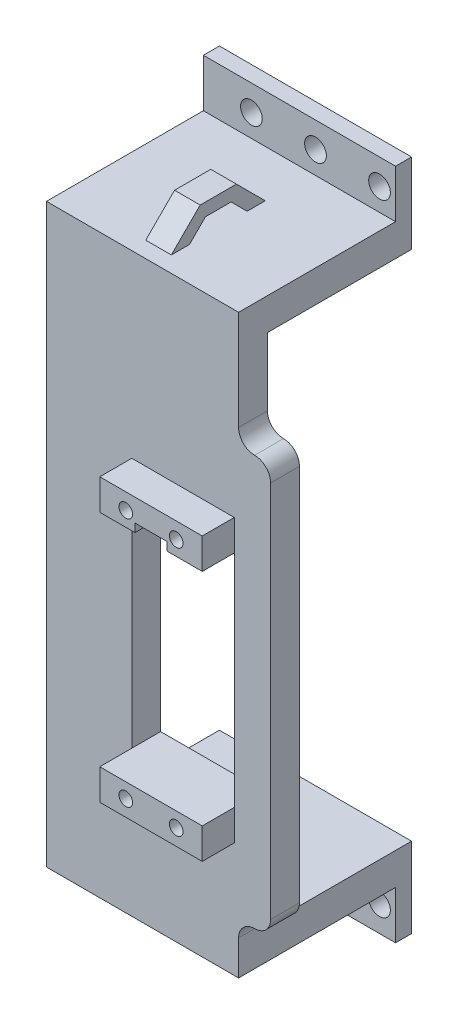
from build123d import *

# Parameters (mm, degrees)
SKETCH1_W             = 76.2
SKETCH1_H             = 114.3
BOSS_EXTRUDE1_DEPTH   = 2.54
SKETCH2_W             = 20.32
SKETCH2_H             = 41.91
CUT_EXTRUDE1_DEPTH    = 138.394983897
SKETCH3_W             = 76.2
SKETCH3_H             = 6.35
BOSS_EXTRUDE2_DEPTH   = 28.575
SKETCH4_W             = 76.2
SKETCH4_H             = 9.525
BOSS_EXTRUDE3_DEPTH   = 3.175
F_6_CLEARANCE_HOLE1_D = 4.3053
SKETCH9_W             = 76.2
SKETCH9_H             = 114.3
SKETCH9_W_2           = 20.32
SKETCH9_H_2           = 41.91
BOSS_EXTRUDE4_DEPTH   = 3.175
SKETCH10_W            = 38.1
SKETCH10_H            = 133.35
CUT_EXTRUDE3_DEPTH    = 150.381641191
SKETCH11_W            = 20.32
SKETCH11_H            = 6.985
BOSS_EXTRUDE5_DEPTH   = 6.35
F_6_32_TAPPED_HOLE1_D = 2.7051
SKETCH15_W            = 6.35
SKETCH15_H            = 2.54
CUT_EXTRUDE4_DEPTH    = 151.965824692
SKETCH16_W            = 20.32
SKETCH16_H            = 43.688
CUT_EXTRUDE5_DEPTH    = 151.965824692
SKETCH17_W            = 6.35
SKETCH17_H            = 81.28
BOSS_EXTRUDE6_DEPTH   = 5.715
FILLET1_START         = -28.575
FILLET1_DEPTH         = 35.575
FILLET1_2_DEPTH       = 5.715
BOSS_EXTRUDE7_START   = -19.05
BOSS_EXTRUDE7_DEPTH   = 2.54


with BuildPart() as part:
    # Sketch1 → Boss-Extrude1 (new body)
    with BuildSketch(Plane.XY):
        with Locations((38.1, 57.15)):
            Rectangle(SKETCH1_W, SKETCH1_H)
    extrude(amount=BOSS_EXTRUDE1_DEPTH)

    # Sketch2 → Cut-Extrude1 (cut, through all)
    with BuildSketch(Plane.XY.offset(2.54)):
        with Locations((65.18148, 50.70348)):
            Rectangle(SKETCH2_W, SKETCH2_H)
    extrude(amount=-CUT_EXTRUDE1_DEPTH, mode=Mode.SUBTRACT)

    # Sketch3 → Boss-Extrude2 (add)
    with BuildSketch(Plane(origin=(0, 0, 0), x_dir=(-1, 0, 0), z_dir=(0, 0, -1))):
        with Locations((-38.1, 111.125)):
            Rectangle(SKETCH3_W, SKETCH3_H)
        with Locations((-38.1, 3.175)):
            Rectangle(SKETCH3_W, SKETCH3_H)
    extrude(amount=BOSS_EXTRUDE2_DEPTH)

    # Sketch4 → Boss-Extrude3 (add)
    with BuildSketch(Plane(origin=(0, 0, -28.575), x_dir=(-1, 0, 0), z_dir=(0, 0, -1))):
        with Locations((-38.1, 119.0625)):
            Rectangle(SKETCH4_W, SKETCH4_H)
        with Locations((-38.1, -4.7625)):
            Rectangle(SKETCH4_W, SKETCH4_H)
    extrude(amount=-BOSS_EXTRUDE3_DEPTH)

    # #6 Clearance Hole1 (through all)
    with Locations(Plane.XY.offset(-25.4)):
        with Locations((9.525, 118.745), (9.525, -4.445), (22.225, -4.445), (34.925, -4.445), (47.625, -4.445), (60.325, -4.445), (22.225, 118.745), (73.025, -4.445), (34.925, 118.745), (47.625, 118.745), (60.325, 118.745), (73.025, 118.745)):
            Hole(F_6_CLEARANCE_HOLE1_D / 2)

    # Sketch9 → Boss-Extrude4 (add)
    with BuildSketch(Plane.XY.offset(2.54)):
        with Locations((38.1, 57.15)):
            Rectangle(SKETCH9_W, SKETCH9_H)
        with Locations((65.18148, 50.70348)):
            Rectangle(SKETCH9_W_2, SKETCH9_H_2, mode=Mode.SUBTRACT)
    extrude(amount=BOSS_EXTRUDE4_DEPTH)

    # Sketch10 → Cut-Extrude3 (cut, through all)
    with BuildSketch(Plane.XY.offset(5.715)):
        with Locations((19.05, 57.15)):
            Rectangle(SKETCH10_W, SKETCH10_H)
    extrude(amount=-CUT_EXTRUDE3_DEPTH, mode=Mode.SUBTRACT)

    # Sketch11 → Boss-Extrude5 (add)
    with BuildSketch(Plane.XY.offset(5.715)):
        with Locations((65.18148, 75.15098)):
            Rectangle(SKETCH11_W, SKETCH11_H)
        with Locations((65.18148, 26.25598)):
            Rectangle(SKETCH11_W, SKETCH11_H)
    extrude(amount=BOSS_EXTRUDE5_DEPTH)

    # #6-32 Tapped Hole1 (through all)
    with Locations(Plane(origin=(0, 0, 0), x_dir=(-1, 0, 0), z_dir=(0, 0, -1))):
        with Locations((-70.18147, 75.45324), (-60.18149, 75.45324), (-60.18149, 25.95372), (-70.18147, 25.95372)):
            Hole(F_6_32_TAPPED_HOLE1_D / 2)

    # Sketch15 → Cut-Extrude4 (cut, through all)
    with BuildSketch(Plane.XY.offset(12.065)):
        with Locations((65.18148, 72.92848)):
            Rectangle(SKETCH15_W, SKETCH15_H)
    extrude(amount=-CUT_EXTRUDE4_DEPTH, mode=Mode.SUBTRACT)

    # Sketch16 → Cut-Extrude5 (cut, through all)
    with BuildSketch(Plane.XY.offset(12.065)):
        with Locations((65.18148, 50.70348)):
            Rectangle(SKETCH16_W, SKETCH16_H)
    extrude(amount=-CUT_EXTRUDE5_DEPTH, mode=Mode.SUBTRACT)

    # Sketch17 → Boss-Extrude6 (add)
    with BuildSketch(Plane.XY.offset(5.715)):
        with Locations((79.375, 50.70348)):
            Rectangle(SKETCH17_W, SKETCH17_H)
    extrude(amount=-BOSS_EXTRUDE6_DEPTH)

    # Fillet1: read off the stored shape, not the designer's step
    # Fillet1 outline → Fillet1 (cut)
    with BuildSketch(Plane.XY.offset(FILLET1_START)):
        with BuildLine():
            ThreePointArc((79.375, 91.34348), (81.62006403, 90.41354403), (82.55, 88.16848))
            Line((82.55, 88.16848), (82.55, 91.34348))
            Line((82.55, 91.34348), (79.375, 91.34348))
        make_face()
        with BuildLine():
            ThreePointArc((82.55, 13.23848), (81.62006403, 10.99341597), (79.375, 10.06348))
            Line((79.375, 10.06348), (82.55, 10.06348))
            Line((82.55, 10.06348), (82.55, 13.23848))
        make_face()
    extrude(amount=FILLET1_DEPTH, mode=Mode.SUBTRACT)

    # Fillet1 2 outline → Fillet1 2 (add)
    with BuildSketch(Plane.XY):
        with BuildLine():
            Line((76.2, 91.34348), (79.375, 91.34348))
            ThreePointArc((79.375, 91.34348), (77.12993597, 92.27341597), (76.2, 94.51848))
            Line((76.2, 94.51848), (76.2, 91.34348))
        make_face()
        with BuildLine():
            ThreePointArc((76.2, 6.88848), (77.12993597, 9.13354403), (79.375, 10.06348))
            Line((79.375, 10.06348), (76.2, 10.06348))
            Line((76.2, 10.06348), (76.2, 6.88848))
        make_face()
    extrude(amount=FILLET1_2_DEPTH)

    # Sketch18 → Boss-Extrude7 (add, symmetric)
    with BuildSketch(Plane.ZY.offset(-38.1).offset(BOSS_EXTRUDE7_START)):
        Polygon((-16.074204897, 114.3), (-10.359204897, 120.015), (-3.175, 120.015), (2.54, 114.3), (-1.052102448, 114.3), (-4.227102448, 117.475), (-9.307102448, 117.475), (-12.482102448, 114.3), align=None)
    boss_extrude7 = extrude(amount=BOSS_EXTRUDE7_DEPTH, both=True)

    # Mirror1: Boss-Extrude7 across plane
    add(boss_extrude7.mirror(Plane.ZX.offset(57.15)))


solid = part.part
